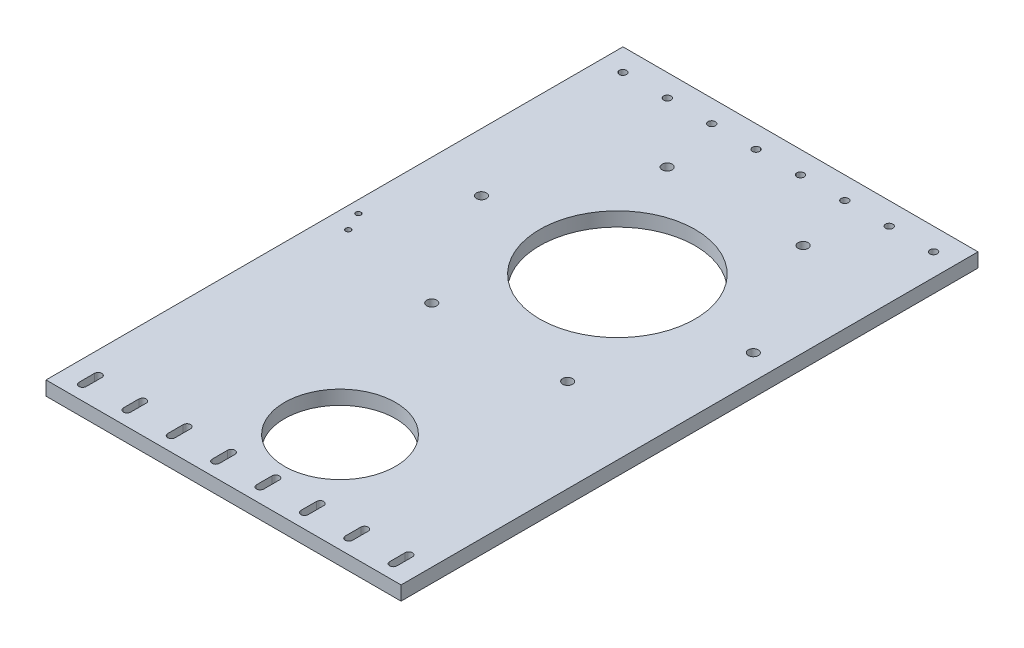
from build123d import *

# Parameters (mm, degrees)
SKETCH1_W           = 160
SKETCH1_H           = 260
SKETCH1_R           = 1.175
SKETCH1_R_2         = 2.25
SKETCH1_R_3         = 25
SKETCH1_R_4         = 1.65
SKETCH1_R_5         = 35
BOSS_EXTRUDE1_DEPTH = 6.35


with BuildPart() as part:
    # Sketch1 → Boss-Extrude1 (new body)
    with BuildSketch(Plane(origin=(0, 0, 0), x_dir=(1, 0, 0), z_dir=(0, 1, 0))):
        with Locations((80, 130)):
            Rectangle(SKETCH1_W, SKETCH1_H)
        with BuildLine():
            ThreePointArc((11.65, 6.5), (10, 4.85), (8.35, 6.5))
            Line((8.35, 6.5), (8.35, 13.5))
            ThreePointArc((8.35, 13.5), (10, 15.15), (11.65, 13.5))
            Line((11.65, 13.5), (11.65, 6.5))
        make_face(mode=Mode.SUBTRACT)
        with BuildLine():
            Line((31.65, 13.5), (31.65, 6.5))
            ThreePointArc((31.65, 6.5), (30, 4.85), (28.35, 6.5))
            Line((28.35, 6.5), (28.35, 13.5))
            ThreePointArc((28.35, 13.5), (30, 15.15), (31.65, 13.5))
        make_face(mode=Mode.SUBTRACT)
        with BuildLine():
            Line((51.65, 13.5), (51.65, 6.5))
            ThreePointArc((51.65, 6.5), (50, 4.85), (48.35, 6.5))
            Line((48.35, 6.5), (48.35, 13.5))
            ThreePointArc((48.35, 13.5), (50, 15.15), (51.65, 13.5))
        make_face(mode=Mode.SUBTRACT)
        with BuildLine():
            Line((71.65, 13.5), (71.65, 6.5))
            ThreePointArc((71.65, 6.5), (70, 4.85), (68.35, 6.5))
            Line((68.35, 6.5), (68.35, 13.5))
            ThreePointArc((68.35, 13.5), (70, 15.15), (71.65, 13.5))
        make_face(mode=Mode.SUBTRACT)
        with Locations((9.516263037, 126.701090269)):
            Circle(SKETCH1_R, mode=Mode.SUBTRACT)
        with Locations((56.875, 116.955944018)):
            Circle(SKETCH1_R_2, mode=Mode.SUBTRACT)
        with BuildLine():
            Line((91.65, 13.5), (91.65, 6.5))
            ThreePointArc((91.65, 6.5), (90, 4.85), (88.35, 6.5))
            Line((88.35, 6.5), (88.35, 13.5))
            ThreePointArc((88.35, 13.5), (90, 15.15), (91.65, 13.5))
        make_face(mode=Mode.SUBTRACT)
        with BuildLine():
            Line((111.65, 13.5), (111.65, 6.5))
            ThreePointArc((111.65, 6.5), (110, 4.85), (108.35, 6.5))
            Line((108.35, 6.5), (108.35, 13.5))
            ThreePointArc((108.35, 13.5), (110, 15.15), (111.65, 13.5))
        make_face(mode=Mode.SUBTRACT)
        with Locations((87.5, 45)):
            Circle(SKETCH1_R_3, mode=Mode.SUBTRACT)
        with BuildLine():
            Line((131.65, 13.5), (131.65, 6.5))
            ThreePointArc((131.65, 6.5), (130, 4.85), (128.35, 6.5))
            Line((128.35, 6.5), (128.35, 13.5))
            ThreePointArc((128.35, 13.5), (130, 15.15), (131.65, 13.5))
        make_face(mode=Mode.SUBTRACT)
        with BuildLine():
            Line((151.65, 13.5), (151.65, 6.5))
            ThreePointArc((151.65, 6.5), (150, 4.85), (148.35, 6.5))
            Line((148.35, 6.5), (148.35, 13.5))
            ThreePointArc((148.35, 13.5), (150, 15.15), (151.65, 13.5))
        make_face(mode=Mode.SUBTRACT)
        with Locations((118.125, 116.955944018)):
            Circle(SKETCH1_R_2, mode=Mode.SUBTRACT)
        with Locations((5.475532842, 135.298909731)):
            Circle(SKETCH1_R, mode=Mode.SUBTRACT)
        with Locations((26.25, 170)):
            Circle(SKETCH1_R_2, mode=Mode.SUBTRACT)
        with Locations((10, 250)):
            Circle(SKETCH1_R_4, mode=Mode.SUBTRACT)
        with Locations((30, 250)):
            Circle(SKETCH1_R_4, mode=Mode.SUBTRACT)
        with Locations((56.875, 223.044055982)):
            Circle(SKETCH1_R_2, mode=Mode.SUBTRACT)
        with Locations((50, 250)):
            Circle(SKETCH1_R_4, mode=Mode.SUBTRACT)
        with Locations((70, 250)):
            Circle(SKETCH1_R_4, mode=Mode.SUBTRACT)
        with Locations((87.5, 170)):
            Circle(SKETCH1_R_5, mode=Mode.SUBTRACT)
        with Locations((148.75, 170)):
            Circle(SKETCH1_R_2, mode=Mode.SUBTRACT)
        with Locations((118.125, 223.044055982)):
            Circle(SKETCH1_R_2, mode=Mode.SUBTRACT)
        with Locations((90, 250)):
            Circle(SKETCH1_R_4, mode=Mode.SUBTRACT)
        with Locations((110, 250)):
            Circle(SKETCH1_R_4, mode=Mode.SUBTRACT)
        with Locations((130, 250)):
            Circle(SKETCH1_R_4, mode=Mode.SUBTRACT)
        with Locations((150, 250)):
            Circle(SKETCH1_R_4, mode=Mode.SUBTRACT)
    extrude(amount=BOSS_EXTRUDE1_DEPTH)


solid = part.part
